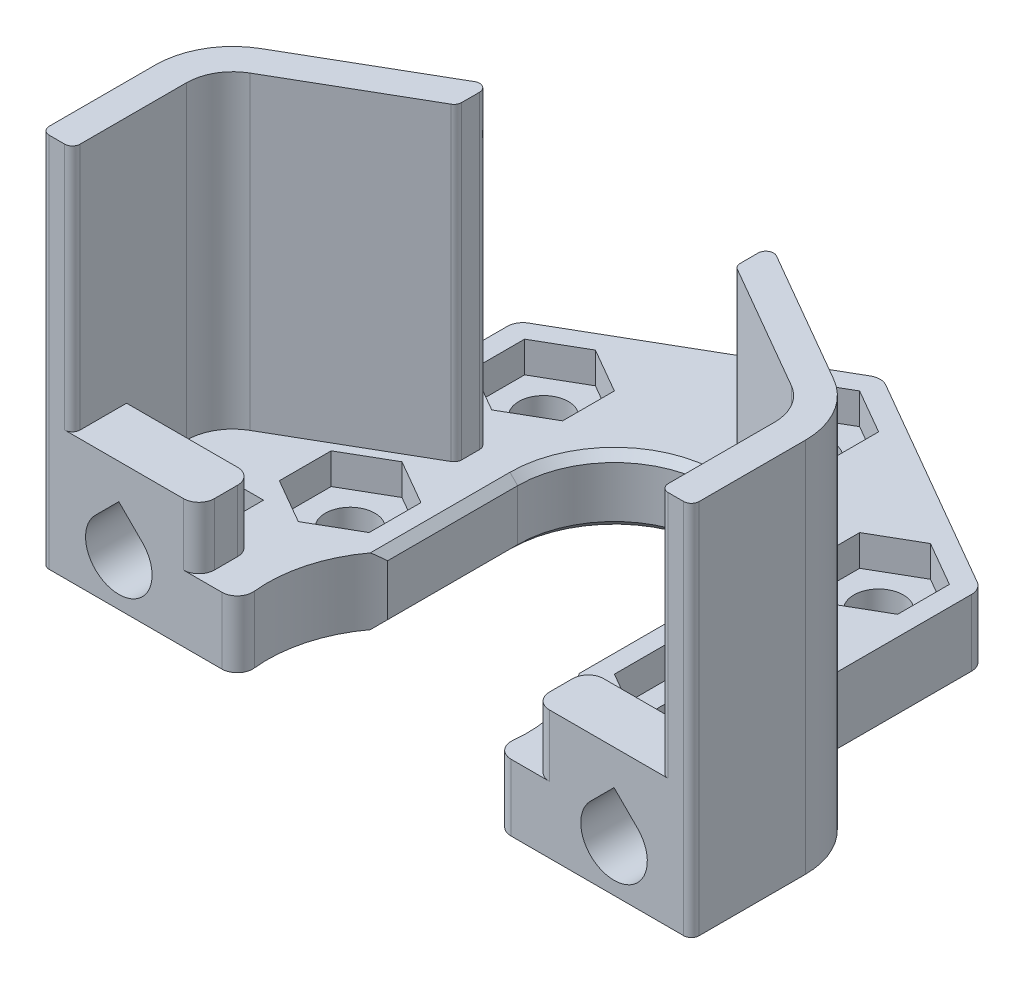
from build123d import *

# Parameters (mm, degrees)
SKETCH1_R                       = 1.6
BOSS_EXTRUDE1_DEPTH             = 4.3
FILLET1_R                       = 1
CUT_EXTRUDE1_DEPTH              = 2
BOSS_EXTRUDE2_DEPTH             = 4.3
SKETCH4_R                       = 8.4
CUT_EXTRUDE2_DEPTH              = 32.552755501
SKETCH5_W                       = 40
SKETCH5_H                       = 8
CUT_EXTRUDE3_DEPTH              = 32.552755501
MOVE_FACE1_DEPTH                = 4.3
BOSS_EXTRUDE3_START             = 4
BOSS_EXTRUDE3_DEPTH             = 4
SKETCH7_R                       = 2.15
CUT_EXTRUDE4_DEPTH              = 3.5
CUT_EXTRUDE5_DEPTH              = 3
SKETCH9_W                       = 21.650635094
SKETCH9_H                       = 3.5
CUT_EXTRUDE6_DEPTH              = 4
FILLET2_R                       = 1
CHAMFER1_SIZE                   = 0.5
CUT_EXTRUDE7_DEPTH              = 3.5
BOSS_EXTRUDE4_REACH             = 28.705
BOSS_EXTRUDE4_DIRECTION_2_DEPTH = 20
FILLET3_R                       = 3
FILLET4_R                       = 5
FILLET5_R                       = 0.5


# Read off the part's stored shape, not the designer's step: Move Face1
with BuildPart() as part:
    # Sketch1 → Boss-Extrude1 (new body)
    with BuildSketch(Plane(origin=(0, 0, 0), x_dir=(1, 0, 0), z_dir=(0, 1, 0))):
        with BuildLine():
            Line((0, 17.320508076), (-15, 8.660254038))
            Line((-15, 8.660254038), (-15, -8.660254038))
            Line((-15, -8.660254038), (-6.25, -13.712068893))
            Line((-6.25, -13.712068893), (-6.25, 0))
            ThreePointArc((-6.25, 0), (0, 6.25), (6.25, 0))
            Line((6.25, 0), (6.25, -13.712068893))
            Line((6.25, -13.712068893), (15, -8.660254038))
            Line((15, -8.660254038), (15, 8.660254038))
            Line((15, 8.660254038), (0, 17.320508076))
        make_face()
        with Locations(Location((0, 12.5, 0), (0, 0, 90))):
            Circle(SKETCH1_R, mode=Mode.SUBTRACT)
        with Locations(Location((10.825317547, 6.25, 0), (0, 0, 90))):
            Circle(SKETCH1_R, mode=Mode.SUBTRACT)
        with Locations(Location((10.825317547, -6.25, 0), (0, 0, 90))):
            Circle(SKETCH1_R, mode=Mode.SUBTRACT)
        with Locations(Location((-10.825317547, -6.25, 0), (0, 0, 90))):
            Circle(SKETCH1_R, mode=Mode.SUBTRACT)
        with Locations(Location((-10.825317547, 6.25, 0), (0, 0, 90))):
            Circle(SKETCH1_R, mode=Mode.SUBTRACT)
    extrude(amount=BOSS_EXTRUDE1_DEPTH)

    # Fillet1
    fillet1_edges = [part.edges().sort_by_distance(p)[0] for p in [
        (15, 2.15, -8.660254038),
        (15, 2.15, 8.660254038),
        (6.25, 2.15, 13.712068893),
        (-6.25, 2.15, 13.712068893),
        (-15, 2.15, 8.660254038),
        (-15, 2.15, -8.660254038),
        (0, 2.15, -17.320508076),
    ]]
    fillet(fillet1_edges, radius=FILLET1_R)

    # Sketch2 → Cut-Extrude1 (cut)
    with BuildSketch(Plane(origin=(0, 4.3, 0), x_dir=(1, 0, 0), z_dir=(0, 1, 0))):
        Polygon((0, 15.848631561), (-2.9, 14.174315781), (-2.9, 10.825684219), (0, 9.151368439), (2.9, 10.825684219), (2.9, 14.174315781), align=None)
        Polygon((13.725317547, 4.575684219), (13.725317547, 7.924315781), (10.825317547, 9.598631561), (7.925317547, 7.924315781), (7.925317547, 4.575684219), (10.825317547, 2.901368439), align=None)
        Polygon((13.725317547, -4.575684219), (10.825317547, -2.901368439), (7.925317547, -4.575684219), (7.925317547, -7.924315781), (10.825317547, -9.598631561), (13.725317547, -7.924315781), align=None)
        Polygon((-13.725317547, -4.575684219), (-13.725317547, -7.924315781), (-10.825317547, -9.598631561), (-7.925317547, -7.924315781), (-7.925317547, -4.575684219), (-10.825317547, -2.901368439), align=None)
        Polygon((-13.725317547, 7.924315781), (-13.725317547, 4.575684219), (-10.825317547, 2.901368439), (-7.925317547, 4.575684219), (-7.925317547, 7.924315781), (-10.825317547, 9.598631561), align=None)
    extrude(amount=-CUT_EXTRUDE1_DEPTH, mode=Mode.SUBTRACT)

    # Sketch3 → Boss-Extrude2 (add)
    with BuildSketch(Plane(origin=(0, 4.3, 0), x_dir=(1, 0, 0), z_dir=(0, 1, 0))):
        with BuildLine():
            Line((-15, -8.082903769), (-6.25, -11.980018086))
            Line((-6.25, -11.980018086), (6.25, -11.980018086))
            Line((6.25, -11.980018086), (15, -8.082903769))
            Line((15, -8.082903769), (20, -10.969655115))
            Line((20, -10.969655115), (20, -22.376680266))
            ThreePointArc((20, -22.376680266), (19.517914755, -23.540537003), (18.354058018, -24.022622248))
            Line((18.354058018, -24.022622248), (-18.354058018, -24.022622248))
            ThreePointArc((-18.354058018, -24.022622248), (-19.517914755, -23.540537003), (-20, -22.376680266))
            Line((-20, -22.376680266), (-20, -10.969655115))
            Line((-20, -10.969655115), (-15, -8.082903769))
        make_face()
    extrude(amount=-BOSS_EXTRUDE2_DEPTH)

    # Sketch4 → Cut-Extrude2 (cut, through all)
    with BuildSketch(Plane(origin=(0, 4.3, 0), x_dir=(1, 0, 0), z_dir=(0, 1, 0))):
        with Locations((0, -14.022622248)):
            Circle(SKETCH4_R)
    extrude(amount=-CUT_EXTRUDE2_DEPTH, mode=Mode.SUBTRACT)

    # Sketch5 → Cut-Extrude3 (cut, through all)
    with BuildSketch(Plane(origin=(0, 4.3, 0), x_dir=(1, 0, 0), z_dir=(0, 1, 0))):
        with Locations((0, -20.022622248)):
            Rectangle(SKETCH5_W, SKETCH5_H)
    extrude(amount=-CUT_EXTRUDE3_DEPTH, mode=Mode.SUBTRACT)

    # Move Face1 outline → Move Face1 (add)
    with BuildSketch(Plane(origin=(0, 0, 0), x_dir=(1, 0, 0), z_dir=(0, 1, 0))):
        Polygon((20, -10.969655115), (20, -5.196152423), (15, -2.309401077), (15, -8.082903769), align=None)
        Polygon((-15, -2.309401077), (-20, -5.196152423), (-20, -10.969655115), (-15, -8.082903769), align=None)
    extrude(amount=MOVE_FACE1_DEPTH)

    # Sketch6 → Boss-Extrude3 (add)
    with BuildSketch(Plane(origin=(0, 4.3, 0), x_dir=(1, 0, 0), z_dir=(0, 1, 0)).offset(BOSS_EXTRUDE3_START)):
        with BuildLine():
            Line((-20, -12.522622248), (-8.264986388, -12.522622248))
            ThreePointArc((-8.264986388, -12.522622248), (-8.396109903, -14.278236217), (-8.158431222, -16.022622248))
            Line((-8.158431222, -16.022622248), (-20, -16.022622248))
            Line((-20, -16.022622248), (-20, -12.522622248))
        make_face()
        with BuildLine():
            Line((8.264986388, -12.522622248), (20, -12.522622248))
            Line((20, -12.522622248), (20, -16.022622248))
            Line((20, -16.022622248), (8.158431222, -16.022622248))
            ThreePointArc((8.158431222, -16.022622248), (8.396109903, -14.278236217), (8.264986388, -12.522622248))
        make_face()
    extrude(amount=-BOSS_EXTRUDE3_DEPTH)

    # Sketch7 → Cut-Extrude4 (cut)
    with BuildSketch(Plane.XY.offset(16.022622248)):
        with Locations((-16, 3)):
            Circle(SKETCH7_R)
        with Locations((16, 3)):
            Circle(SKETCH7_R)
    extrude(amount=-CUT_EXTRUDE4_DEPTH, mode=Mode.SUBTRACT)

    # Sketch8 → Cut-Extrude5 (cut)
    with BuildSketch(Plane(origin=(0, 0, 12.522622248), x_dir=(-1, 0, 0), z_dir=(0, 0, -1))):
        Polygon((16, 6.290896534), (13.15, 4.645448267), (13.15, 1.354551733), (16, -0.290896534), (18.85, 1.354551733), (18.85, 4.645448267), align=None)
        Polygon((-18.85, 4.645448267), (-16, 6.290896534), (-13.15, 4.645448267), (-13.15, 1.354551733), (-16, -0.290896534), (-18.85, 1.354551733), align=None)
    extrude(amount=CUT_EXTRUDE5_DEPTH, mode=Mode.SUBTRACT)

    # Sketch9 → Cut-Extrude6 (cut)
    with BuildSketch(Plane(origin=(0, 4.3, 0), x_dir=(1, 0, 0), z_dir=(0, 1, 0))):
        with Locations((0, -14.272622248)):
            Rectangle(SKETCH9_W, SKETCH9_H)
    extrude(amount=CUT_EXTRUDE6_DEPTH, mode=Mode.SUBTRACT)

    # Fillet2
    fillet2_edges = [part.edges().sort_by_distance(p)[0] for p in [
        (20, 2.15, 5.196152423),
        (-20, 2.15, 5.196152423),
        (8.158431222, 2.15, 16.022622248),
        (20, 6.3, 12.522622248),
        (-20, 6.3, 12.522622248),
        (-8.158431222, 2.15, 16.022622248),
        (-10.825317547, 6.3, 16.022622248),
        (10.825317547, 6.3, 12.522622248),
        (-10.825317547, 6.3, 12.522622248),
        (10.825317547, 6.3, 16.022622248),
        (15, 2.15, 2.309401077),
        (-15, 2.15, 2.309401077),
    ]]
    fillet(fillet2_edges, radius=FILLET2_R)

    # Chamfer1
    chamfer1_edges = [part.edges().sort_by_distance(p)[0] for p in [
        (0, 4.3, -6.25),
        (6.25, 4.3, 4.205179445),
        (-6.25, 4.3, 4.205179445),
        (-6.25, 0, 4.205179445),
        (6.25, 0, 4.205179445),
        (0, 0, -6.25),
    ]]
    chamfer(chamfer1_edges, length=CHAMFER1_SIZE)

    # Sketch10 → Cut-Extrude7 (cut)
    with BuildSketch(Plane.XY.offset(16.022622248)):
        with BuildLine():
            Line((-17.52027958, 4.52027958), (-16, 6.040559159))
            Line((-16, 6.040559159), (-14.47972042, 4.52027958))
            ThreePointArc((-14.47972042, 4.52027958), (-16, 0.85), (-17.52027958, 4.52027958))
        make_face()
        with BuildLine():
            Line((14.47972042, 4.52027958), (16, 6.040559159))
            Line((16, 6.040559159), (17.52027958, 4.52027958))
            ThreePointArc((17.52027958, 4.52027958), (16, 0.85), (14.47972042, 4.52027958))
        make_face()
    extrude(amount=-CUT_EXTRUDE7_DEPTH, mode=Mode.SUBTRACT)

    # Boss-Extrude4: up to this face of the body (flat: up to its plane)
    boss_extrude4_end = Plane(part.part.faces().sort_by_distance((-8.607291251, 0, 11.682408659))[0])
    # Sketch11 → Boss-Extrude4 (add, up to the picked face)
    with BuildSketch(Plane(origin=(0, 4.3, 0), x_dir=(1, 0, 0), z_dir=(0, 1, 0)), mode=Mode.PRIVATE) as boss_extrude4_sk1:
        Polygon((9, -1.154700538), (19, -6.92820323), (19, -16.022622248), (21, -16.022622248), (21, -5.773502692), (9, 1.154700538), align=None)
    boss_extrude4_tool1 = split(extrude(boss_extrude4_sk1.sketch, amount=-BOSS_EXTRUDE4_REACH, mode=Mode.PRIVATE), bisect_by=boss_extrude4_end, keep=Keep.BOTH, mode=Mode.PRIVATE)
    # Sketch11 → Boss-Extrude4 (add, up to the picked face)
    with BuildSketch(Plane(origin=(0, 4.3, 0), x_dir=(1, 0, 0), z_dir=(0, 1, 0)), mode=Mode.PRIVATE) as boss_extrude4_sk2:
        Polygon((-9, 1.154700538), (-9, -1.154700538), (-19, -6.92820323), (-19, -16.022622248), (-21, -16.022622248), (-21, -5.773502692), align=None)
    boss_extrude4_tool2 = split(extrude(boss_extrude4_sk2.sketch, amount=-BOSS_EXTRUDE4_REACH, mode=Mode.PRIVATE), bisect_by=boss_extrude4_end, keep=Keep.BOTH, mode=Mode.PRIVATE)
    add(boss_extrude4_tool1.solids().sort_by(Axis((14.104769, 4.3, 3.859987), (0, -1, 0)))[0])
    add(boss_extrude4_tool2.solids().sort_by(Axis((-9.209538, 4.3, 0), (0, -1, 0)))[0])

    # Sketch11 → Boss-Extrude4 direction 2 (add)
    with BuildSketch(Plane(origin=(0, 4.3, 0), x_dir=(1, 0, 0), z_dir=(0, 1, 0))):
        Polygon((9, -1.154700538), (19, -6.92820323), (19, -16.022622248), (21, -16.022622248), (21, -5.773502692), (9, 1.154700538), align=None)
        Polygon((-9, 1.154700538), (-9, -1.154700538), (-19, -6.92820323), (-19, -16.022622248), (-21, -16.022622248), (-21, -5.773502692), align=None)
    extrude(amount=BOSS_EXTRUDE4_DIRECTION_2_DEPTH)

    # Fillet3
    fillet3_edges = [part.edges().sort_by_distance(p)[0] for p in [
        (19, 14.3, 6.92820323),
        (-19, 14.3, 6.92820323),
    ]]
    fillet(fillet3_edges, radius=FILLET3_R)

    # Fillet4
    fillet4_edges = [part.edges().sort_by_distance(p)[0] for p in [
        (21, 12.15, 5.773502692),
        (-21, 12.15, 5.773502692),
    ]]
    fillet(fillet4_edges, radius=FILLET4_R)

    # Fillet5
    fillet5_edges = [part.edges().sort_by_distance(p)[0] for p in [
        (9, 14.3, -1.154700538),
        (9, 14.3, 1.154700538),
        (19, 16.3, 16.022622248),
        (21, 12.15, 16.022622248),
        (-9, 14.3, -1.154700538),
        (-21, 12.15, 16.022622248),
        (-19, 16.3, 16.022622248),
        (-9, 14.3, 1.154700538),
    ]]
    fillet(fillet5_edges, radius=FILLET5_R)


solid = part.part
